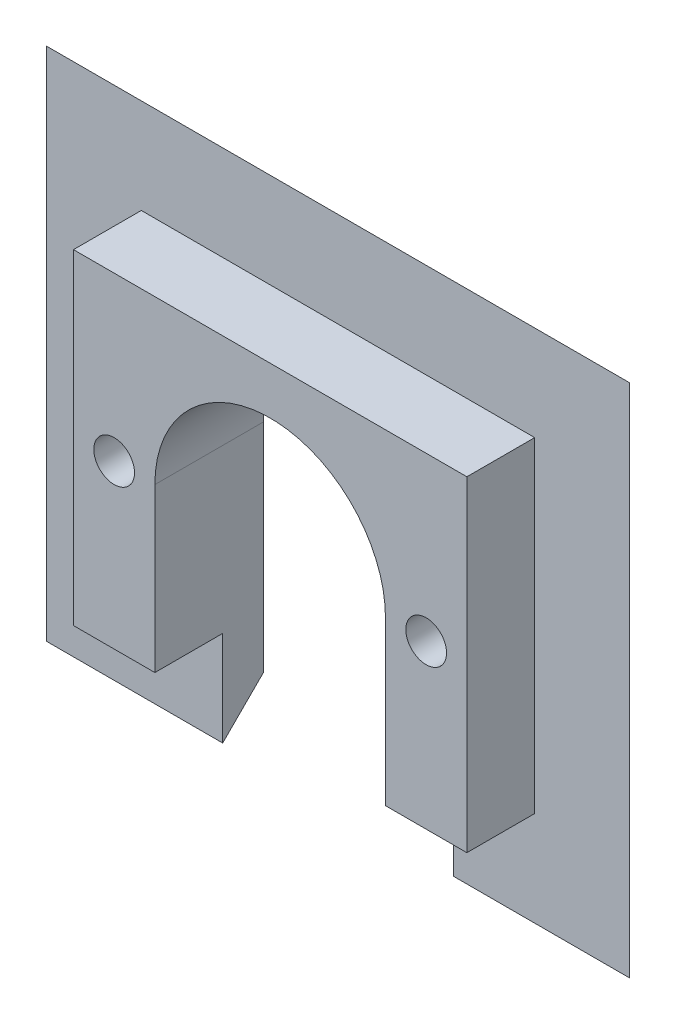
from build123d import *

# Parameters (mm, degrees)
EXTRUDE_1_DEPTH     = 5
EXTRUDE_START       = 3
EXTRUDE_2_DEPTH     = 3
SKETCH_3_R          = 1.5
CUT_EXTRUDE_1_DEPTH = 30.786742017
CHAMFER_1_SIZE      = 3


with BuildPart() as part:
    # ｽｹｯﾁ1 → ﾎﾞｽ - 押し出し1 (new body)
    with BuildSketch(Plane.XY):
        with BuildLine():
            ThreePointArc((-8.5, 0), (0, 8.5), (8.5, 0))
            Line((8.5, 0), (8.5, -12))
            Line((8.5, -12), (14.5, -12))
            Line((14.5, -12), (14.5, 12))
            Line((14.5, 12), (-14.5, 12))
            Line((-14.5, 12), (-14.5, -12))
            Line((-14.5, -12), (-8.5, -12))
            Line((-8.5, -12), (-8.5, 0))
        make_face()
    extrude(amount=EXTRUDE_1_DEPTH)

    # ｽｹｯﾁ2 → ﾎﾞｽ - 押し出し2 (add)
    with BuildSketch(Plane(origin=(0, 0, 0), x_dir=(-1, 0, 0), z_dir=(0, 0, -1)).offset(EXTRUDE_START)):
        with BuildLine():
            Line((8.5, -12), (8.5, -19))
            Line((8.5, -19), (21.5, -19))
            Line((21.5, -19), (21.5, 19))
            Line((21.5, 19), (-21.5, 19))
            Line((-21.5, 19), (-21.5, -19))
            Line((-21.5, -19), (-8.5, -19))
            Line((-8.5, -19), (-8.5, -12))
            Line((-8.5, -12), (-8.5, 0))
            ThreePointArc((-8.5, 0), (0, 8.5), (8.5, 0))
            Line((8.5, 0), (8.5, -12))
        make_face()
    extrude(amount=-EXTRUDE_2_DEPTH)

    # ｽｹｯﾁ3 → ｶｯﾄ - 押し出し1 (cut, through all)
    with BuildSketch(Plane.XY.offset(5)):
        with Locations((11.5, 0)):
            Circle(SKETCH_3_R)
        with Locations((-11.5, 0)):
            Circle(SKETCH_3_R)
    extrude(amount=-CUT_EXTRUDE_1_DEPTH, mode=Mode.SUBTRACT)

    # 面取り1
    chamfer_1_edges = [part.edges().sort_by_distance(p)[0] for p in [
        (15, -19, -3),
        (21.5, 0, -3),
        (0, 19, -3),
        (-21.5, 0, -3),
        (-15, -19, -3),
    ]]
    chamfer(chamfer_1_edges, length=CHAMFER_1_SIZE - 0.0001)  # a hair under: the kernel refuses the full size


solid = part.part
